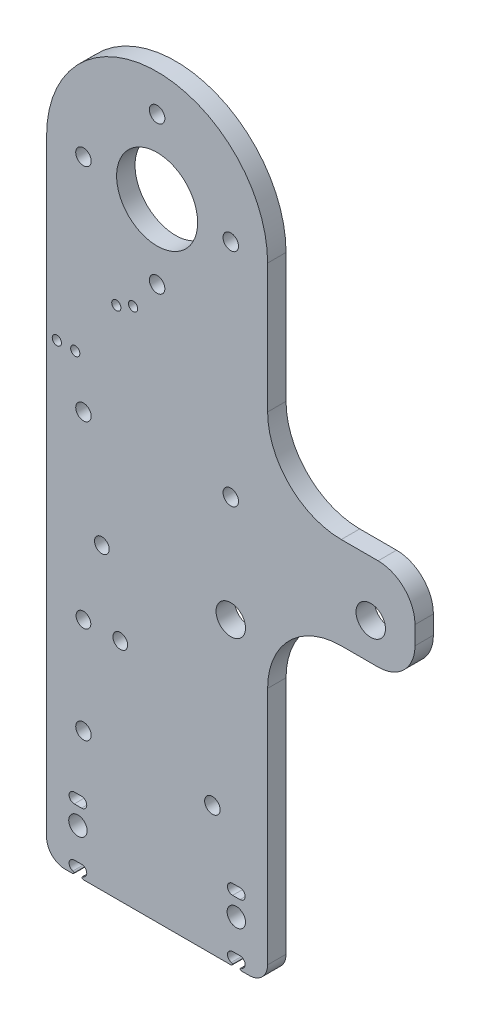
from build123d import *

# Parameters (mm, degrees)
SKETCH1_R           = 2.5
SKETCH1_R_2         = 1.250000001
SKETCH1_R_3         = 1.25
SKETCH1_R_4         = 2.1
SKETCH1_R_5         = 11
BOSS_EXTRUDE1_DEPTH = 2.5
CUT_EXTRUDE15_REACH = 140.384
SKETCH15_R          = 2.1
FILLET1_R           = 5
FILLET2_R           = 0.5
SKETCH21_R          = 2
SKETCH21_R_2        = 4
CUT_EXTRUDE21_DEPTH = 139.383525031
SKETCH22_W          = 40
SKETCH22_H          = 25
SKETCH22_R          = 4
BOSS_EXTRUDE2_DEPTH = 5
FILLET10_R          = 20
FILLET11_R          = 10


with BuildPart() as part:
    # Sketch1 → Boss-Extrude1 (new, symmetric)
    with BuildSketch(Plane.XY):
        with BuildLine():
            ThreePointArc((20.5, -64.4), (19.1, -63), (20.5, -61.6))
            Line((20.5, -61.6), (22.5, -61.6))
            ThreePointArc((22.5, -61.6), (23.9, -63), (22.5, -64.4))
            Line((22.5, -64.4), (22.5, -65))
            Line((22.5, -65), (30, -65))
            Line((30, -65), (30, 105))
            ThreePointArc((30, 105), (0, 135), (-30, 105))
            Line((-30, 105), (-30, -65))
            Line((-30, -65), (-22.5, -65))
            Line((-22.5, -65), (-22.5, -64.4))
            ThreePointArc((-22.5, -64.4), (-23.9, -63), (-22.5, -61.6))
            Line((-22.5, -61.6), (-20.5, -61.6))
            ThreePointArc((-20.5, -61.6), (-19.1, -63), (-20.5, -64.4))
            Line((-20.5, -64.4), (-20.5, -65))
            Line((-20.5, -65), (20.5, -65))
            Line((20.5, -65), (20.5, -64.4))
        make_face()
        with Locations((-21.5, -53)):
            Circle(SKETCH1_R, mode=Mode.SUBTRACT)
        with BuildLine():
            Line((-20.5, -48.4), (-22.5, -48.4))
            ThreePointArc((-22.5, -48.4), (-23.9, -47), (-22.5, -45.6))
            Line((-22.5, -45.6), (-20.5, -45.6))
            ThreePointArc((-20.5, -45.6), (-19.1, -47), (-20.5, -48.4))
        make_face(mode=Mode.SUBTRACT)
        with Locations((21.5, -53)):
            Circle(SKETCH1_R, mode=Mode.SUBTRACT)
        with BuildLine():
            ThreePointArc((22.5, -45.6), (23.9, -47), (22.5, -48.4))
            Line((22.5, -48.4), (20.5, -48.4))
            ThreePointArc((20.5, -48.4), (19.1, -47), (20.5, -45.6))
            Line((20.5, -45.6), (22.5, -45.6))
        make_face(mode=Mode.SUBTRACT)
        with Locations((-27.222941247, 58.222284236)):
            Circle(SKETCH1_R_2, mode=Mode.SUBTRACT)
        with Locations((-22.222941247, 58.222284236)):
            Circle(SKETCH1_R_2, mode=Mode.SUBTRACT)
        with Locations((-11.076110698, 74.544863638)):
            Circle(SKETCH1_R_3, mode=Mode.SUBTRACT)
        with Locations((-6.51035255, 76.582963865)):
            Circle(SKETCH1_R_3, mode=Mode.SUBTRACT)
        with Locations((-20, 105)):
            Circle(SKETCH1_R_4, mode=Mode.SUBTRACT)
        with Locations((0, 105)):
            Circle(SKETCH1_R_5, mode=Mode.SUBTRACT)
        with Locations((0, 125)):
            Circle(SKETCH1_R_4, mode=Mode.SUBTRACT)
        with Locations((0, 85)):
            Circle(SKETCH1_R_4, mode=Mode.SUBTRACT)
        with Locations((20, 105)):
            Circle(SKETCH1_R_4, mode=Mode.SUBTRACT)
    extrude(amount=BOSS_EXTRUDE1_DEPTH, both=True)

    # Sketch15 → Cut-Extrude15 (cut, up to next)
    with BuildSketch(Plane(origin=(0, 0, -2.5), x_dir=(-1, 0, 0), z_dir=(0, 0, -1)), mode=Mode.PRIVATE) as cut_extrude15_sk1:
        with Locations((20, -30)):
            Circle(SKETCH15_R)
    cut_extrude15_tool1 = extrude(cut_extrude15_sk1.sketch, amount=-CUT_EXTRUDE15_REACH, mode=Mode.PRIVATE) & part.part
    # Sketch15 → Cut-Extrude15 (cut, up to next)
    with BuildSketch(Plane(origin=(0, 0, -2.5), x_dir=(-1, 0, 0), z_dir=(0, 0, -1)), mode=Mode.PRIVATE) as cut_extrude15_sk2:
        with Locations((-15, -30)):
            Circle(SKETCH15_R)
    cut_extrude15_tool2 = extrude(cut_extrude15_sk2.sketch, amount=-CUT_EXTRUDE15_REACH, mode=Mode.PRIVATE) & part.part
    # Sketch15 → Cut-Extrude15 (cut, up to next)
    with BuildSketch(Plane(origin=(0, 0, -2.5), x_dir=(-1, 0, 0), z_dir=(0, 0, -1)), mode=Mode.PRIVATE) as cut_extrude15_sk3:
        with Locations((-20, 45)):
            Circle(SKETCH15_R)
    cut_extrude15_tool3 = extrude(cut_extrude15_sk3.sketch, amount=-CUT_EXTRUDE15_REACH, mode=Mode.PRIVATE) & part.part
    # Sketch15 → Cut-Extrude15 (cut, up to next)
    with BuildSketch(Plane(origin=(0, 0, -2.5), x_dir=(-1, 0, 0), z_dir=(0, 0, -1)), mode=Mode.PRIVATE) as cut_extrude15_sk4:
        with Locations((20, 45)):
            Circle(SKETCH15_R)
    cut_extrude15_tool4 = extrude(cut_extrude15_sk4.sketch, amount=-CUT_EXTRUDE15_REACH, mode=Mode.PRIVATE) & part.part
    add(cut_extrude15_tool1.solids().sort_by_distance((-20, -30, -2.5))[0], mode=Mode.SUBTRACT)
    add(cut_extrude15_tool2.solids().sort_by_distance((15, -30, -2.5))[0], mode=Mode.SUBTRACT)
    add(cut_extrude15_tool3.solids().sort_by_distance((20, 45, -2.5))[0], mode=Mode.SUBTRACT)
    add(cut_extrude15_tool4.solids().sort_by_distance((-20, 45, -2.5))[0], mode=Mode.SUBTRACT)

    # Fillet1
    fillet1_edges = [part.edges().sort_by_distance(p)[0] for p in [
        (-30, -65, 0),
        (30, -65, 0),
    ]]
    fillet(fillet1_edges, radius=FILLET1_R)

    # Fillet2
    # the kernel refuses this fillet: 0.5 mm, written as the material it takes off along each edge
    with BuildSketch(Plane(origin=(22.5, -65, -3.75), x_dir=(1, 0, 0), z_dir=(0, 0, 1)), Plane(origin=(-20.5, -65, 3.75), x_dir=(0, 1, 0), z_dir=(0, 0, -1))) as fillet2_piece_1:
        with BuildLine():
            CenterArc((FILLET2_R, FILLET2_R), FILLET2_R, 180, 90)
            Line((0, FILLET2_R), (0, 0))
            Line((0, 0), (FILLET2_R, 0))
        make_face()
    extrude(amount=7.5, mode=Mode.SUBTRACT)
    with BuildSketch(Plane(origin=(22.5, -64.4, -3.582575695), x_dir=(0, -1, 0), z_dir=(0, 0, 1))) as fillet2_piece_2:
        with BuildLine():
            CenterArc((0.433030278, 0.5), FILLET2_R, 195.25752329, 74.74247671)
            ThreePointArc((-0.049346111, 0.368421053), (-0.012391366, 0.185855529), (0, 0))
            Line((0, 0), (0.433030278, 0))
        make_face()
    extrude(amount=7.16515139, mode=Mode.SUBTRACT)
    with BuildSketch(Plane(origin=(20.5, -64.4, -3.582575695), x_dir=(0, -1, 0), z_dir=(0, 0, 1)), Plane(origin=(-22.5, -64.4, -3.582575695), x_dir=(0, -1, 0), z_dir=(0, 0, 1))) as fillet2_piece_3:
        with BuildLine():
            CenterArc((0.433030278, -0.5), FILLET2_R, 90, 74.74247671)
            ThreePointArc((-0.049346111, -0.368421053), (-0.012391366, -0.185855529), (0, 0))
            Line((0, 0), (0.433030278, 0))
        make_face()
    extrude(amount=7.16515139, mode=Mode.SUBTRACT)
    with BuildSketch(Plane(origin=(20.5, -65, -3.75), x_dir=(-1, 0, 0), z_dir=(0, 0, 1)), Plane(origin=(-22.5, -65, -3.75), x_dir=(-1, 0, 0), z_dir=(0, 0, 1))) as fillet2_piece_4:
        with BuildLine():
            CenterArc((FILLET2_R, -FILLET2_R), FILLET2_R, 90, 90)
            Line((0, -FILLET2_R), (0, 0))
            Line((0, 0), (FILLET2_R, 0))
        make_face()
    extrude(amount=7.5, mode=Mode.SUBTRACT)
    with BuildSketch(Plane(origin=(-20.5, -64.4, 3.582575695), x_dir=(0.9911490245884916, 0.1327539493095473, 0), z_dir=(0, 0, -1))) as fillet2_piece_5:
        with BuildLine():
            CenterArc((0.438088033, 0.495574512), FILLET2_R, 187.628761645, 74.74247671)
            Line((-0.05748648, 0.429197538), (0, 0))
            ThreePointArc((0, 0), (0.185855529, 0.012391366), (0.371711058, 0))
        make_face()
    extrude(amount=7.16515139, mode=Mode.SUBTRACT)

    # Sketch21 → Cut-Extrude21 (cut, through all)
    with BuildSketch(Plane.XY.offset(2.5)):
        with Locations((-20, -3.840572854)):
            Circle(SKETCH21_R)
        with Locations((-10, -3.840572854)):
            Circle(SKETCH21_R)
        with Locations((-15, 16.159427146)):
            Circle(SKETCH21_R)
        with Locations((20, 16.159427146)):
            Circle(SKETCH21_R_2)
    extrude(amount=-CUT_EXTRUDE21_DEPTH, mode=Mode.SUBTRACT)

    # Sketch22 → Boss-Extrude2 (add)
    with BuildSketch(Plane.XY.offset(2.5)):
        with Locations((50, 37.5)):
            Rectangle(SKETCH22_W, SKETCH22_H)
        with Locations((58, 35)):
            Circle(SKETCH22_R, mode=Mode.SUBTRACT)
    extrude(amount=-BOSS_EXTRUDE2_DEPTH)

    # Fillet10
    fillet10_edges = [part.edges().sort_by_distance(p)[0] for p in [
        (30, 25, 0),
        (30, 50, 0),
    ]]
    fillet(fillet10_edges, radius=FILLET10_R)

    # Fillet11
    fillet11_edges = [part.edges().sort_by_distance(p)[0] for p in [
        (70, 50, 0),
        (70, 25, 0),
    ]]
    fillet(fillet11_edges, radius=FILLET11_R)


solid = part.part
